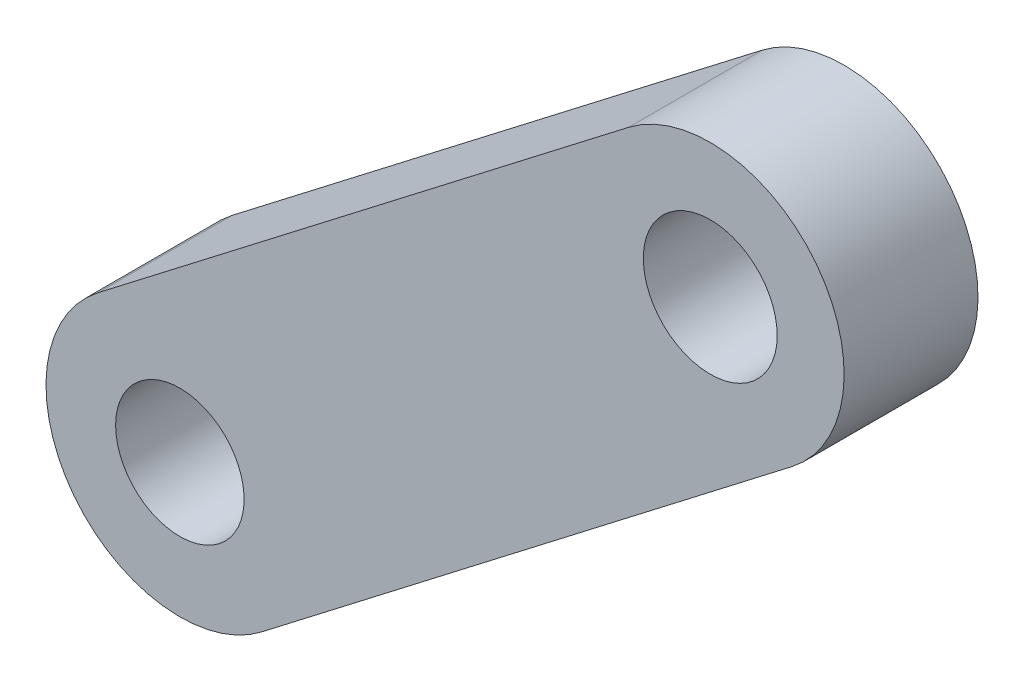
from build123d import *

# Parameters (mm, degrees)
SKETCH1_R           = 2.5
BOSS_EXTRUDE1_DEPTH = 5
SKETCH2_R           = 2.4
CUT_EXTRUDE1_DEPTH  = 5
CUT_EXTRUDE2_DEPTH  = 1


with BuildPart() as part:
    # Sketch1 → Boss-Extrude1 (new body)
    with BuildSketch(Plane(origin=(0, 0, 0), x_dir=(0.9997573026985189, -0.022030335925312537, 0), z_dir=(0, 0, 1))):
        with BuildLine():
            Line((-29.904437649, 103.275259833), (-49.372163993, 87.590629426))
            ThreePointArc((-49.372163993, 87.590629426), (-50.12878318, 80.560158076), (-43.09831183, 79.803538889))
            Line((-43.09831183, 79.803538889), (-23.630585486, 95.488169295))
            ThreePointArc((-23.630585486, 95.488169295), (-23.225758684, 95.852410595), (-22.86294507, 96.25851741))
            ThreePointArc((-22.86294507, 96.25851741), (-23.238207598, 102.923467448), (-29.904437649, 103.275259833))
        make_face()
        with Locations((-26.767511567, 99.381714564)):
            Circle(SKETCH1_R, mode=Mode.SUBTRACT)
    extrude(amount=BOSS_EXTRUDE1_DEPTH)

    # Sketch2 → Cut-Extrude1 (cut)
    with BuildSketch(Plane(origin=(0, 0, 0), x_dir=(-1, 0, 0), z_dir=(0, 0, -1))):
        with Locations((44.380141864, 84.695348924)):
            Circle(SKETCH2_R)
    extrude(amount=-CUT_EXTRUDE1_DEPTH, mode=Mode.SUBTRACT)

    # Sketch4 → Cut-Extrude2 (cut)
    with BuildSketch(Plane(origin=(0, 0, 0), x_dir=(-1, 0, 0), z_dir=(0, 0, -1))):
        Polygon((38.237095204, 87.532175923), (40.067328392, 89.909200633), (41.210775583, 87.135659842), align=None)
    extrude(amount=-CUT_EXTRUDE2_DEPTH, mode=Mode.SUBTRACT)


solid = part.part
